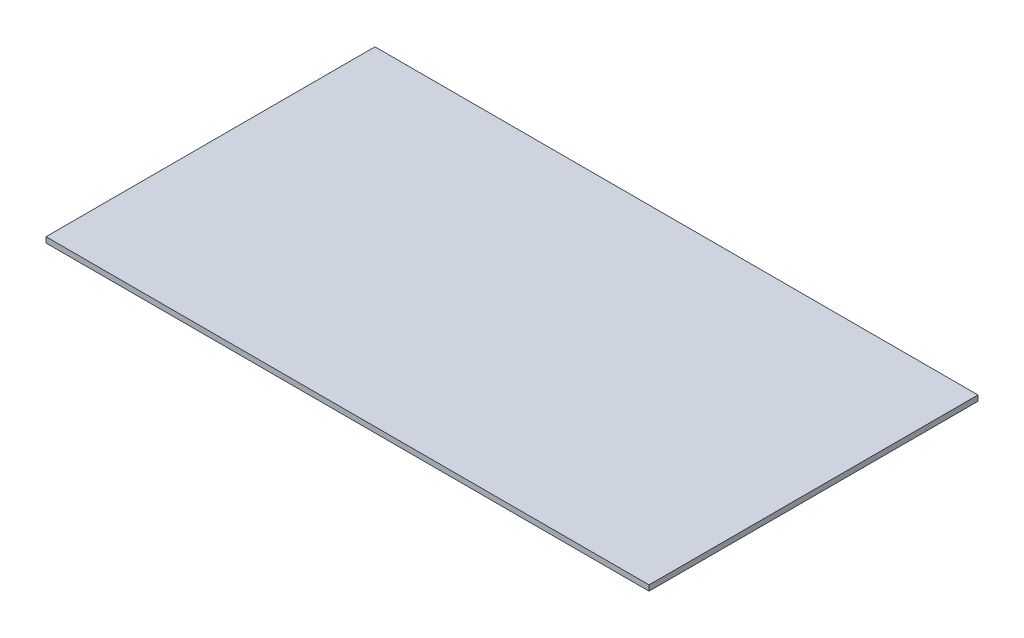
from build123d import *

# Parameters (mm, degrees)
SKETCH1_W           = 279.4
SKETCH1_H           = 152.4
BOSS_EXTRUDE1_DEPTH = 2.54


with BuildPart() as part:
    # Sketch1 → Boss-Extrude1 (new body)
    with BuildSketch(Plane(origin=(0, 0, 0), x_dir=(1, 0, 0), z_dir=(0, 1, 0))):
        with Locations((-105.991588785, 81.185046729)):
            Rectangle(SKETCH1_W, SKETCH1_H)
    extrude(amount=BOSS_EXTRUDE1_DEPTH)


solid = part.part
